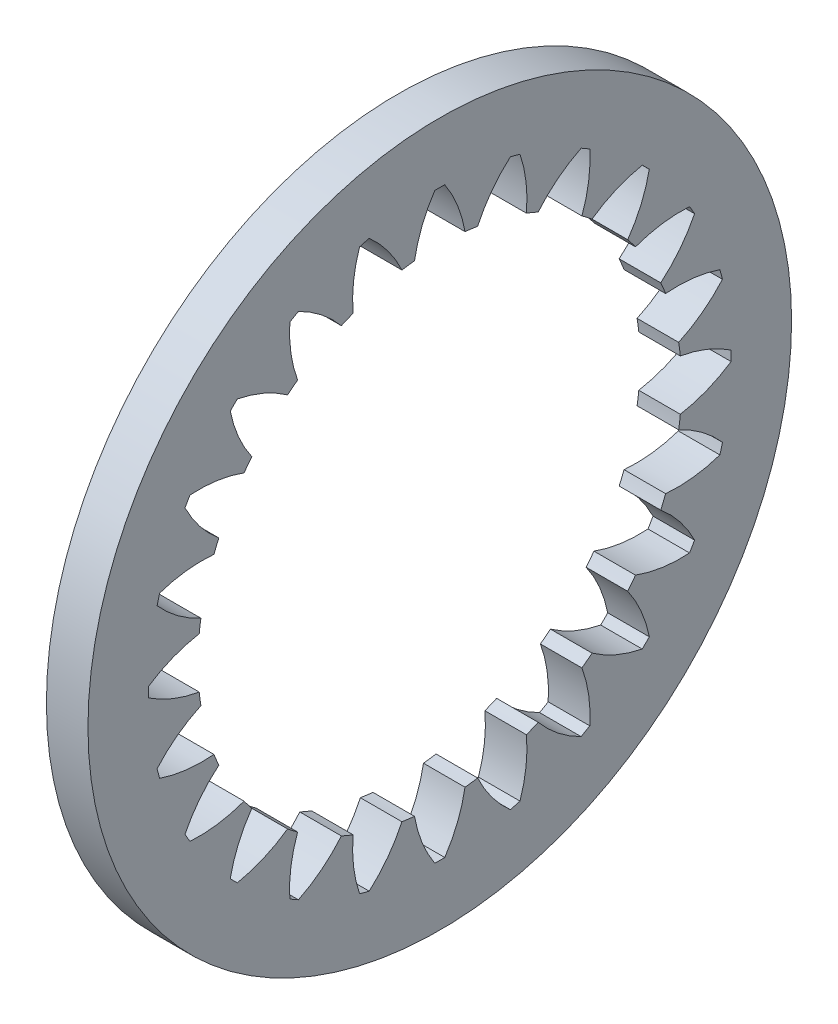
from build123d import *

# Parameters (mm, degrees)
BASPROSKE_W     = 12
BASPROSKE_H     = 31.75
TOOTHCUT_DEPTH  = 145.184326471
TEETHCUTS_COUNT = 24
TEETHCUTS_ANGLE = 345


with BuildPart() as part:
    # BasProSke → Base-Revolve (revolve)
    with BuildSketch(Plane(origin=(0, 0, 0), x_dir=(1, 0, 0), z_dir=(0, 1, 0))):
        with Locations((6, 85.725)):
            Rectangle(BASPROSKE_W, BASPROSKE_H)
    revolve(axis=Axis((-10, 0, 0), (1, 0, 0)))

    # TooCutSke → ToothCut (cut, through all)
    with BuildSketch(Plane(origin=(0, 0, 0), x_dir=(0, 0, -1), z_dir=(1, 0, 0))):
        with BuildLine():
            ThreePointArc((7.294804836, 69.442498425), (5.138539952, 77.091294309), (1.442489481, 84.126403948))
            ThreePointArc((1.442489481, 84.126403948), (0, 84.13877), (-1.442489481, 84.126403948))
            ThreePointArc((-1.442489481, 84.126403948), (-5.138539952, 77.091294309), (-7.294804836, 69.442498425))
            ThreePointArc((-7.294804836, 69.442498425), (0, 69.8246), (7.294804836, 69.442498425))
        make_face()
    toothcut = extrude(amount=TOOTHCUT_DEPTH, mode=Mode.SUBTRACT)

    # TeethCuts: ToothCut ×24 about axis
    teethcuts_axis = Axis((-10, 0, 0), (1, 0, 0))
    for i in range(1, TEETHCUTS_COUNT):
        add(toothcut.rotate(teethcuts_axis, i * TEETHCUTS_ANGLE / (TEETHCUTS_COUNT - 1)), mode=Mode.SUBTRACT)


solid = part.part
